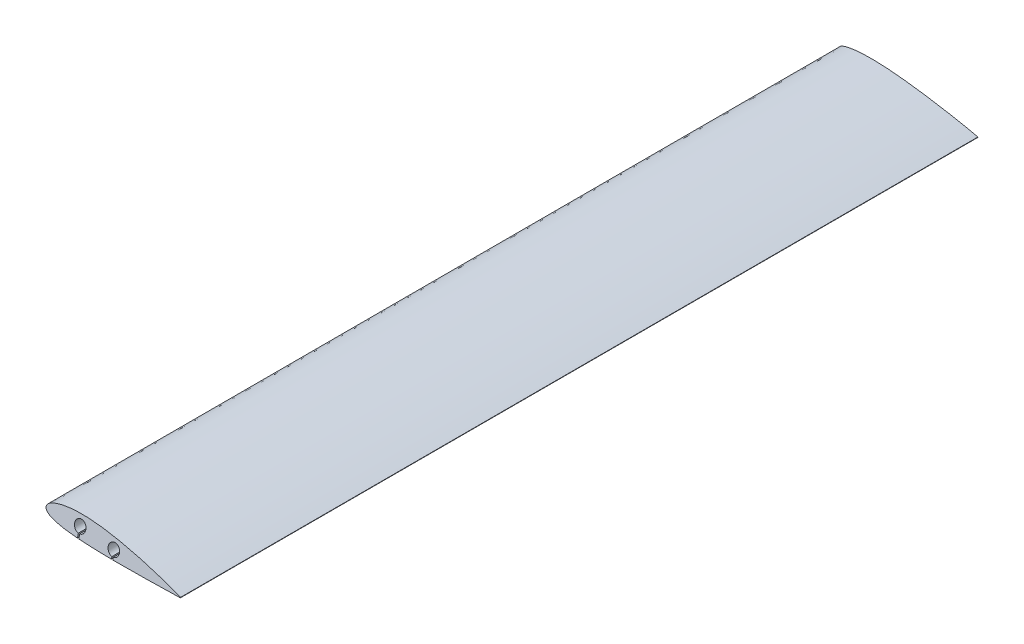
from build123d import *

# Parameters (mm, degrees)
BOSS_EXTRUDE2_DEPTH = 350
CUT_EXTRUDE1_DEPTH  = 711.224434787
CUT_EXTRUDE2_DEPTH  = 371.025333859


with BuildPart() as part:
    # Sketch4 → Boss-Extrude2 (new, symmetric)
    with BuildSketch(Plane.XY):
        with BuildLine():
            Line((119.719991, -8.194807), (119.695381, -8.546747))
            add(Edge.make_bspline(
                [(119.719991, -8.194807), (119.61764841, -8.162240637), (119.19852199, -8.028870715), (118.249798127, -7.745031658), (116.676407839, -7.268167047), (114.493663789, -6.622884733), (111.726015897, -5.819790748), (108.398911724, -4.884219391), (104.547361929, -3.835831807), (100.210480042, -2.700118173), (95.433518904, -1.500300802), (90.26665007, -0.264432397), (84.764196939, 0.982802719), (78.984832074, 2.213154384), (72.990565093, 3.400840681), (66.847177822, 4.523443731), (60.620063953, 5.548323318), (54.377201887, 6.457087683), (48.169212025, 7.230239705), (42.062055962, 7.814819192), (36.125885631, 8.177280278), (30.449573966, 8.314898796), (25.10011413, 8.227027534), (20.140497454, 7.925510347), (15.629317101, 7.418070092), (11.618053763, 6.73224369), (8.152072895, 5.88821562), (5.265461615, 4.917741635), (2.980043391, 3.844064955), (1.306313196, 2.68412251), (0.233450763, 1.415363385), (-0.125677219, -0.004012473), (0.315982361, -1.397057642), (1.446876939, -2.60229726), (3.155286628, -3.673260822), (5.44258821, -4.64999205), (8.296391193, -5.528567241), (11.691656295, -6.304005547), (15.592735851, -6.975417454), (19.959874276, -7.539800005), (24.747208164, -8.001982516), (29.905609886, -8.372521768), (35.382276774, -8.659673599), (41.121264783, -8.881234399), (47.081706403, -9.055454783), (53.20279353, -9.188054907), (59.420373682, -9.253631676), (65.648672415, -9.27165644), (71.81843885, -9.259174649), (77.861615392, -9.220305458), (83.711911843, -9.164511417), (89.304379991, -9.100372346), (94.576933576, -9.02926376), (99.470365861, -8.953698328), (103.92963669, -8.880525843), (107.903976991, -8.807503392), (111.34829566, -8.737267734), (114.222791177, -8.676904433), (116.494264736, -8.623938921), (118.135824982, -8.585910023), (119.132644448, -8.557903842), (119.580133448, -8.549031904), (119.695381, -8.546747)],
                knots=[0, 0, 0, 0, 0.00130837, 0.005358202, 0.012063409, 0.0213373, 0.03308662, 0.047170644, 0.063440896, 0.081714353, 0.101785004, 0.123442227, 0.146433395, 0.170516871, 0.195424313, 0.220875125, 0.246594095, 0.272301833, 0.297725322, 0.322799378, 0.347028844, 0.370161528, 0.391953613, 0.412187724, 0.430670141, 0.447230522, 0.461731543, 0.474085213, 0.484275747, 0.492391838, 0.498749378, 0.504100298, 0.509453026, 0.515789796, 0.523837664, 0.533884866, 0.546005346, 0.560170802, 0.5762844, 0.594211189, 0.613803377, 0.634869302, 0.657209968, 0.680611019, 0.70483465, 0.729852899, 0.755196949, 0.780582679, 0.805728553, 0.830359479, 0.854204496, 0.877002462, 0.898493682, 0.918442716, 0.936623368, 0.952825662, 0.966867902, 0.978592201, 0.987851656, 0.994547444, 0.998595734, 1, 1, 1, 1], degree=3))
        make_face()
    extrude(amount=BOSS_EXTRUDE2_DEPTH, both=True)

    # Sketch5 → Cut-Extrude1 (cut, through all)
    with BuildSketch(Plane(origin=(0, 0, -350), x_dir=(-1, 0, 0), z_dir=(0, 0, -1))):
        with BuildLine():
            Line((-29.4, -8.323435595), (-29.4, -4.913501806))
            ThreePointArc((-29.4, -4.913501806), (-30, 4.95), (-30.6, -4.913501806))
            Line((-30.6, -4.913501806), (-30.6, -8.397486845))
            add(Edge.make_bspline(
                [(-30.6, -8.397486845), (-30.334048259, -8.381641875), (-29.934029948, -8.357256483), (-29.534064174, -8.332001555), (-29.4, -8.323435595)],
                knots=[0.361885056, 0.361885056, 0.361885056, 0.361885056, 0.365130698, 0.366767224, 0.366767224, 0.366767224, 0.366767224], degree=3))
        make_face()
        with BuildLine():
            add(Edge.make_bspline(
                [(-60.6, -9.252757876), (-60.205663057, -9.250658895), (-59.805662946, -9.248259355), (-59.405664333, -9.245565772), (-59.4, -9.245527569)],
                knots=[0.239999017, 0.239999017, 0.239999017, 0.239999017, 0.244803051, 0.244872057, 0.244872057, 0.244872057, 0.244872057], degree=3))
            Line((-59.4, -9.245527569), (-59.4, -7.413501806))
            ThreePointArc((-59.4, -7.413501806), (-60, 2.45), (-60.6, -7.413501806))
            Line((-60.6, -7.413501806), (-60.6, -9.252757876))
        make_face()
    extrude(amount=-CUT_EXTRUDE1_DEPTH, mode=Mode.SUBTRACT)

    # Sketch6 → Cut-Extrude2 (cut, symmetric)
    with BuildSketch(Plane(origin=(0, 0, 0), x_dir=(0, 0, -1), z_dir=(1, 0, 0))):
        Polygon((350, -9.5), (345.122717422, 12.5), (350, 12.5), align=None)
    cut_extrude2 = extrude(amount=CUT_EXTRUDE2_DEPTH, both=True, mode=Mode.SUBTRACT)

    # Mirror1: Cut-Extrude2 across plane
    add(cut_extrude2.mirror(Plane.XY), mode=Mode.SUBTRACT)


solid = part.part
